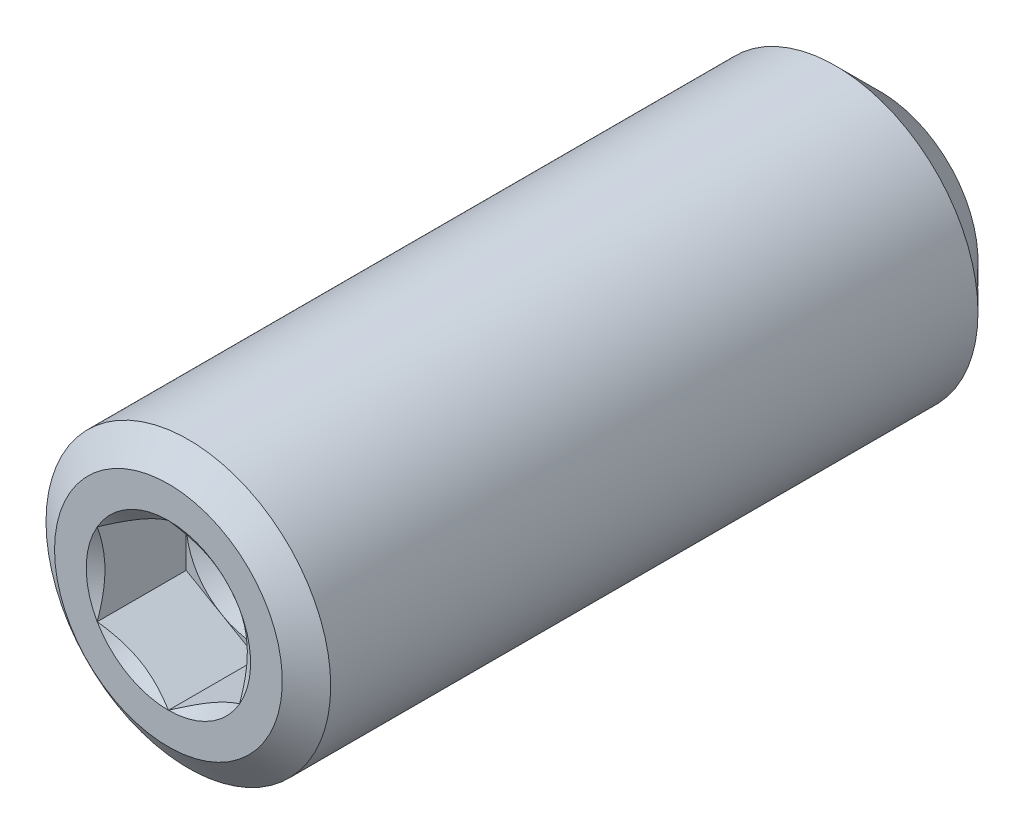
from build123d import *

# Parameters (mm, degrees)
CUT_EXTRUDE10_DEPTH = 2.5


with BuildPart() as part:
    # Sketch22 → Revolve1 (revolve)
    with BuildSketch(Plane(origin=(0, 0, 0), x_dir=(0, 0, -1), z_dir=(1, 0, 0))):
        Polygon((-10, 0), (-10, 3.2), (-9.439833969, 4), (8.75, 4), (10, 2.75), (10, 0), align=None)
    revolve(axis=Axis((0, 0, -10), (0, 0, 1)))

    # Sketch23 → Cut-Extrude10 (cut)
    with BuildSketch(Plane.XY.offset(10)):
        Polygon((0, 2.309401077), (-2, 1.154700538), (-2, -1.154700538), (0, -2.309401077), (2, -1.154700538), (2, 1.154700538), align=None)
    extrude(amount=-CUT_EXTRUDE10_DEPTH, mode=Mode.SUBTRACT)

    # Cut-Extrude11 cone 1 section (through the dimple's axis) → Cut-Extrude11 (revolve, cut)
    with BuildSketch(Plane(origin=(0, 0, 10), x_dir=(0, -1, 0), z_dir=(1, 0, 0))):
        Polygon((0, 0), (2.309401077, 0), (0, 1.617060043), align=None)
    revolve(axis=Axis((0, 0, 10), (0, 0, -1)), mode=Mode.SUBTRACT)

    # Cut-Extrude12 cone 1 section (through the dimple's axis) → Cut-Extrude12 (revolve, cut)
    with BuildSketch(Plane(origin=(0, 0, 7.5), x_dir=(0, -1, 0), z_dir=(1, 0, 0))):
        Polygon((0, 0), (2, 0), (0, 1.154700538), align=None)
    revolve(axis=Axis((0, 0, 7.5), (0, 0, -1)), mode=Mode.SUBTRACT)


solid = part.part
